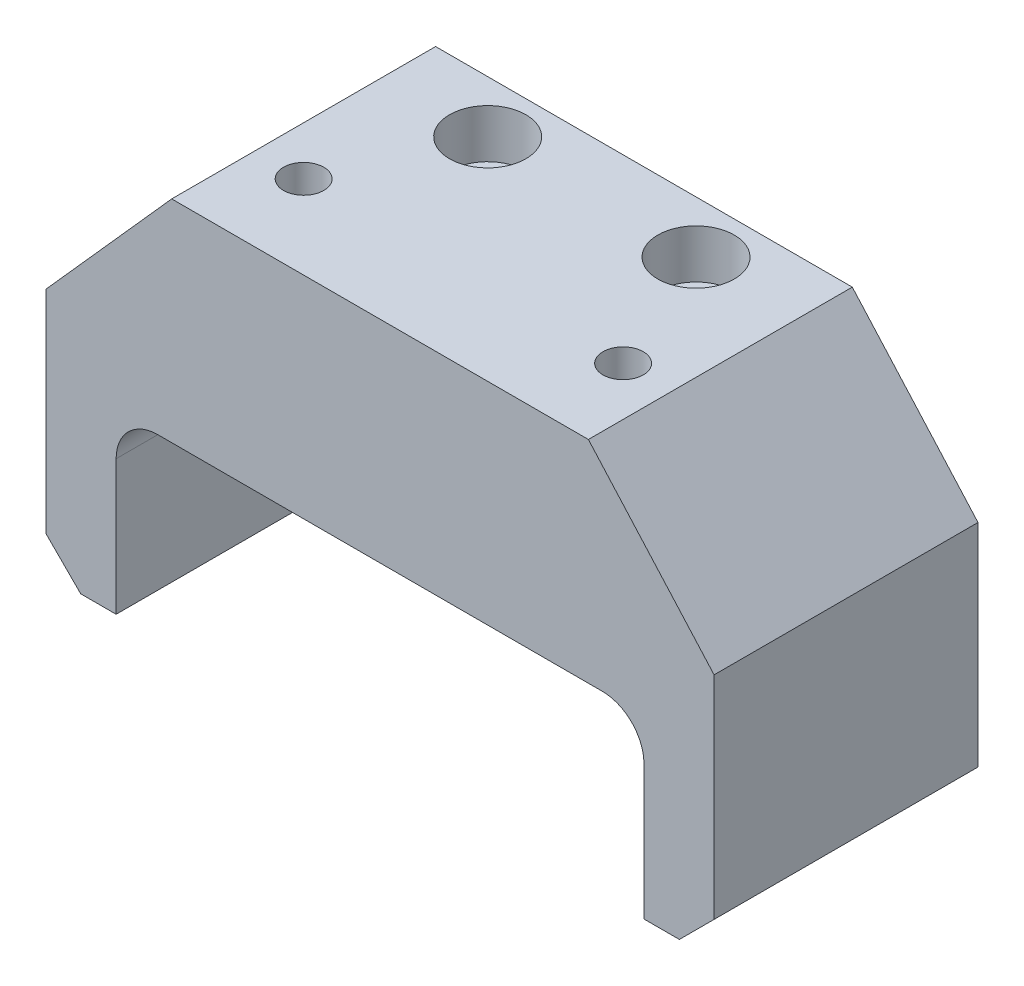
from build123d import *

# Parameters (mm, degrees)
BOSS_EXTRUDE1_DEPTH = 19
CUT_EXTRUDE8_DEPTH  = 79.978794622
FILLET1_R           = 6
SKETCH2_R           = 3.05
CUT_EXTRUDE1_DEPTH  = 42
SKETCH3_R           = 5.5
CUT_EXTRUDE2_DEPTH  = 7
SKETCH8_R           = 2.9
CUT_EXTRUDE7_DEPTH  = 23
CHAMFER2_SIZE       = 5


with BuildPart() as part:
    # Sketch1 → Boss-Extrude1 (new, symmetric)
    with BuildSketch(Plane.XY):
        Polygon((48.1, 6), (-48.1, 6), (-48.1, -49.8), (-38, -49.8), (-38, -24.4), (38, -24.4), (38, -49.8), (48.1, -49.8), align=None)
    extrude(amount=BOSS_EXTRUDE1_DEPTH, both=True)

    # Sketch9 → Cut-Extrude8 (cut, through all)
    with BuildSketch(Plane.XY.offset(19)):
        Polygon((-30, 6), (-48.1, -14.3), (-48.1, 6), align=None)
        Polygon((48.1, 6), (30, 6), (48.1, -14.3), align=None)
    extrude(amount=-CUT_EXTRUDE8_DEPTH, mode=Mode.SUBTRACT)

    # Fillet1
    fillet1_edges = [part.edges().sort_by_distance(p)[0] for p in [
        (38, -24.4, 0),
        (-38, -24.4, 0),
    ]]
    fillet(fillet1_edges, radius=FILLET1_R)

    # Sketch2 → Cut-Extrude1 (cut)
    with BuildSketch(Plane(origin=(0, 6, 0), x_dir=(1, 0, 0), z_dir=(0, 1, 0))):
        with Locations((-15, 11.5)):
            Circle(SKETCH2_R)
        with Locations((15, 11.5)):
            Circle(SKETCH2_R)
    extrude(amount=-CUT_EXTRUDE1_DEPTH, mode=Mode.SUBTRACT)

    # Sketch3 → Cut-Extrude2 (cut)
    with BuildSketch(Plane(origin=(0, 6, 0), x_dir=(1, 0, 0), z_dir=(0, 1, 0))):
        with Locations((-15, 11.5)):
            Circle(SKETCH3_R)
        with Locations((15, 11.5)):
            Circle(SKETCH3_R)
    extrude(amount=-CUT_EXTRUDE2_DEPTH, mode=Mode.SUBTRACT)

    # Sketch8 → Cut-Extrude7 (cut)
    with BuildSketch(Plane(origin=(0, 6, 0), x_dir=(1, 0, 0), z_dir=(0, 1, 0))):
        with Locations((-23, -7)):
            Circle(SKETCH8_R)
        with Locations((23, -7)):
            Circle(SKETCH8_R)
    extrude(amount=-CUT_EXTRUDE7_DEPTH, mode=Mode.SUBTRACT)

    # Chamfer2
    chamfer2_edges = [part.edges().sort_by_distance(p)[0] for p in [
        (48.1, -49.8, 0),
        (-48.1, -49.8, 0),
    ]]
    chamfer(chamfer2_edges, length=CHAMFER2_SIZE)


solid = part.part
